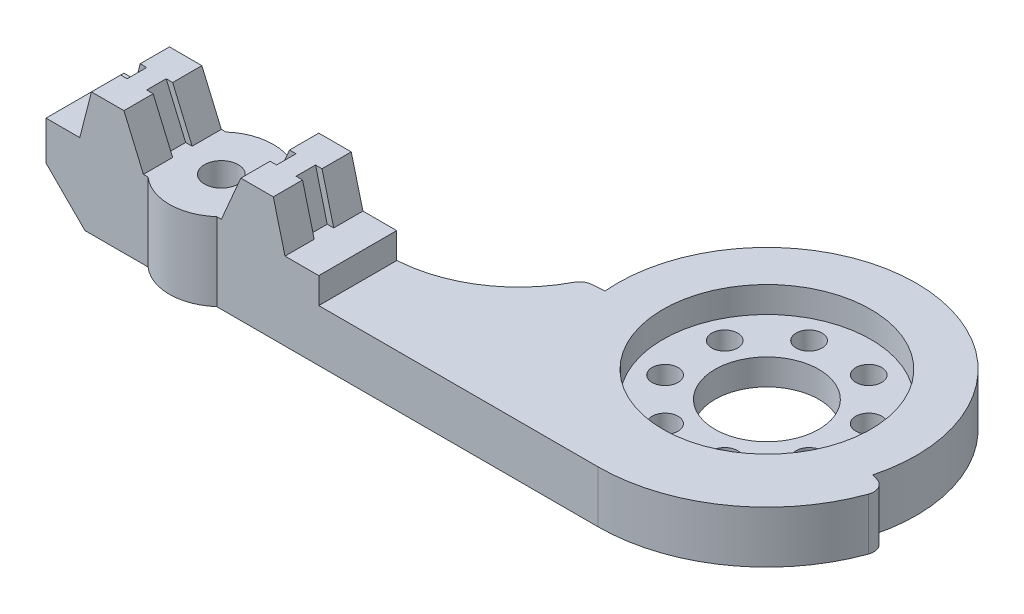
from build123d import *

# Parameters (mm, degrees)
EXTRUDE_1_DEPTH              = 4
FILLET_1_R                   = 10
FILLET_2_R                   = 1
SKETCH_2_W                   = 21
SKETCH_2_H                   = 6
EXTRUDE_2_DEPTH              = 2
SKETCH_3_R                   = 4
EXTRUDE_3_DEPTH              = 6
HOLE_WIZARD_M2_1_D           = 2.6
HOLE_WIZARD_M2_1_CBORE_D     = 6.2
HOLE_WIZARD_M2_1_CBORE_DEPTH = 2
CHAMFER_1_SIZE               = 3
EXTRUDE_4_DEPTH              = 6
CUT_EXTRUDE_2_DEPTH          = 0.75
HOLE_WIZARD_M2_2_D           = 8
HOLE_WIZARD_M2_2_CBORE_D     = 16
HOLE_WIZARD_M2_2_CBORE_DEPTH = 2
SKETCH_9_R                   = 1
CUT_EXTRUDE_1_DEPTH          = 2
PATTERN_CIRCULAR_1_COUNT     = 8


with BuildPart() as part:
    # ｽｹｯﾁ1 → ﾎﾞｽ - 押し出し1 (new body)
    with BuildSketch(Plane(origin=(0, 0, 0), x_dir=(1, 0, 0), z_dir=(0, 1, 0))):
        with BuildLine():
            Line((21.04554885, 3), (19, 3))
            Line((19, 3), (-10.5, 3))
            Line((-10.5, 3), (-10.5, -3))
            Line((-10.5, -3), (32, -3))
            ThreePointArc((32, -3), (25.755002002, -1.401754251), (21.04554885, 3))
        make_face()
        with BuildLine():
            Line((19.049468925, 8.866975344), (19, 8.862647374))
            Line((19, 8.862647374), (19, 3))
            Line((19, 3), (21.04554885, 3))
            ThreePointArc((21.04554885, 3), (19.692790986, 5.812804485), (19.049468925, 8.866975344))
        make_face()
        with BuildLine():
            Line((20.543760972, 8.997708958), (19.049468925, 8.866975344))
            ThreePointArc((19.049468925, 8.866975344), (19.692790986, 5.812804485), (21.04554885, 3))
            Line((21.04554885, 3), (22.875856205, 3))
            ThreePointArc((22.875856205, 3), (21.281736732, 5.832406867), (20.543760972, 8.997708958))
        make_face()
        with BuildLine():
            Line((32, 10), (20.543760972, 8.997708958))
            ThreePointArc((20.543760972, 8.997708958), (21.281736732, 5.832406867), (22.875856205, 3))
            Line((22.875856205, 3), (32, 3))
            Line((32, 3), (32, -1.5))
            ThreePointArc((32, -1.5), (39.000756434, 0.876436587), (43.108147002, 7.023580981))
            Line((43.108147002, 7.023580981), (32, 10))
        make_face()
        with BuildLine():
            ThreePointArc((43.5, 10), (31.498377045, 21.489054548), (20.543760972, 8.997708958))
            Line((20.543760972, 8.997708958), (32, 10))
            Line((32, 10), (43.108147002, 7.023580981))
            ThreePointArc((43.108147002, 7.023580981), (43.401615906, 8.498948789), (43.5, 10))
        make_face()
        with BuildLine():
            Line((32, 3), (22.875856205, 3))
            ThreePointArc((22.875856205, 3), (26.913252513, -0.313825672), (32, -1.5))
            Line((32, -1.5), (32, 3))
        make_face()
        with BuildLine():
            Line((22.875856205, 3), (21.04554885, 3))
            ThreePointArc((21.04554885, 3), (25.755002002, -1.401754251), (32, -3))
            Line((32, -3), (32, -1.5))
            ThreePointArc((32, -1.5), (26.913252513, -0.313825672), (22.875856205, 3))
        make_face()
        with BuildLine():
            ThreePointArc((32, -3), (39.913898577, -0.313593424), (44.557035742, 6.635352414))
            Line((44.557035742, 6.635352414), (43.108147002, 7.023580981))
            ThreePointArc((43.108147002, 7.023580981), (39.000756434, 0.876436587), (32, -1.5))
            Line((32, -1.5), (32, -3))
        make_face()
    extrude(amount=EXTRUDE_1_DEPTH)

    # ﾌｨﾚｯﾄ1
    # the kernel refuses this fillet: 10 mm, written as the material it adds along each edge
    with BuildSketch(Plane(origin=(19, 0, -3), x_dir=(-1, 0, 0), z_dir=(0, 1, 0))) as fillet_1_piece_1:
        with BuildLine():
            CenterArc((9.103972388, -10), FILLET_1_R, 90, 65.560304835)
            Line((0, -5.862647374), (-0.182079448, -5.779900322))
            ThreePointArc((-0.182079448, -5.779900322), (-0.2, -2.931323687), (-0.2, 0))
            Line((-0.2, 0), (0, 0.2))
            Line((0, 0.2), (9.103972388, 0.2))
            Line((9.103972388, 0.2), (9.103972388, 0))
        make_face()
    extrude(amount=4)

    # ﾌｨﾚｯﾄ2
    fillet_2_edges = [part.edges().sort_by_distance(p)[0] for p in [
        (44.557035742, 2, -6.635352414),
        (19, 2, -8.862647374),
    ]]
    fillet(fillet_2_edges, radius=FILLET_2_R)

    # ｽｹｯﾁ2 → ﾎﾞｽ - 押し出し2 (add)
    with BuildSketch(Plane(origin=(0, 4, 0), x_dir=(1, 0, 0), z_dir=(0, 1, 0))):
        Rectangle(SKETCH_2_W, SKETCH_2_H)
    extrude(amount=EXTRUDE_2_DEPTH)

    # ｽｹｯﾁ3 → ﾎﾞｽ - 押し出し3 (add)
    with BuildSketch(Plane(origin=(0, 6, 0), x_dir=(1, 0, 0), z_dir=(0, 1, 0))):
        Circle(SKETCH_3_R)
    extrude(amount=-EXTRUDE_3_DEPTH)

    # M2 丸平ねじ用座ぐり穴1 (through all)
    with Locations(Plane(origin=(0, 0, 0), x_dir=(-1, 0, 0), z_dir=(0, -1, 0))):
        with Locations((0, 0)):
            CounterBoreHole(HOLE_WIZARD_M2_1_D / 2, HOLE_WIZARD_M2_1_CBORE_D / 2, HOLE_WIZARD_M2_1_CBORE_DEPTH)

    # 面取り1
    chamfer_1_edges = [part.edges().sort_by_distance(p)[0] for p in [
        (-10.5, 0, 0),
    ]]
    chamfer(chamfer_1_edges, length=CHAMFER_1_SIZE)

    # ｽｹｯﾁ6 → ﾎﾞｽ - 押し出し4 (add)
    with BuildSketch(Plane.XY.offset(3)):
        Polygon((3, 6), (4.5, 9.5), (7, 9.5), (7.9, 6), align=None)
    extrude_4 = extrude(amount=-EXTRUDE_4_DEPTH)

    # ｽｹｯﾁ10 → ｶｯﾄ - 押し出し2 (cut, symmetric)
    with BuildSketch(Plane.XY):
        Polygon((5, 9.5), (4.5, 9.5), (3, 6), (3.5, 6), align=None)
        Polygon((6.5, 9.5), (7, 9.5), (7.9, 6), (7.4, 6), align=None)
    cut_extrude_2 = extrude(amount=CUT_EXTRUDE_2_DEPTH, both=True, mode=Mode.SUBTRACT)

    # ﾐﾗｰ1: ﾎﾞｽ - 押し出し4, ｶｯﾄ - 押し出し2 across plane
    add(extrude_4.mirror(Plane(origin=(0, 0, 0), x_dir=(0, 0, 1), z_dir=(1, 0, 0))))
    add(cut_extrude_2.mirror(Plane(origin=(0, 0, 0), x_dir=(0, 0, 1), z_dir=(1, 0, 0))), mode=Mode.SUBTRACT)

    # M2 丸平ねじ用座ぐり穴2 (through all)
    with Locations(Plane(origin=(0, 4, 0), x_dir=(1, 0, 0), z_dir=(0, 1, 0))):
        with Locations((32, 10)):
            CounterBoreHole(HOLE_WIZARD_M2_2_D / 2, HOLE_WIZARD_M2_2_CBORE_D / 2, HOLE_WIZARD_M2_2_CBORE_DEPTH)

    # ｽｹｯﾁ9 → ｶｯﾄ - 押し出し1 (cut)
    with BuildSketch(Plane(origin=(0, 2, 0), x_dir=(1, 0, 0), z_dir=(0, 1, 0))):
        with Locations(Location((29.703899406, 15.543277195, 0), (0, 0, 270))):
            Circle(SKETCH_9_R)
    cut_extrude_1 = extrude(amount=-CUT_EXTRUDE_1_DEPTH, mode=Mode.SUBTRACT)

    # 円形ﾊﾟﾀｰﾝ1: ｶｯﾄ - 押し出し1 ×8 about axis
    pattern_circular_1_axis = Axis((32, 0, -10), (0, 1, 0))
    for i in range(1, PATTERN_CIRCULAR_1_COUNT):
        add(cut_extrude_1.rotate(pattern_circular_1_axis, i * 360 / PATTERN_CIRCULAR_1_COUNT), mode=Mode.SUBTRACT)


solid = part.part
